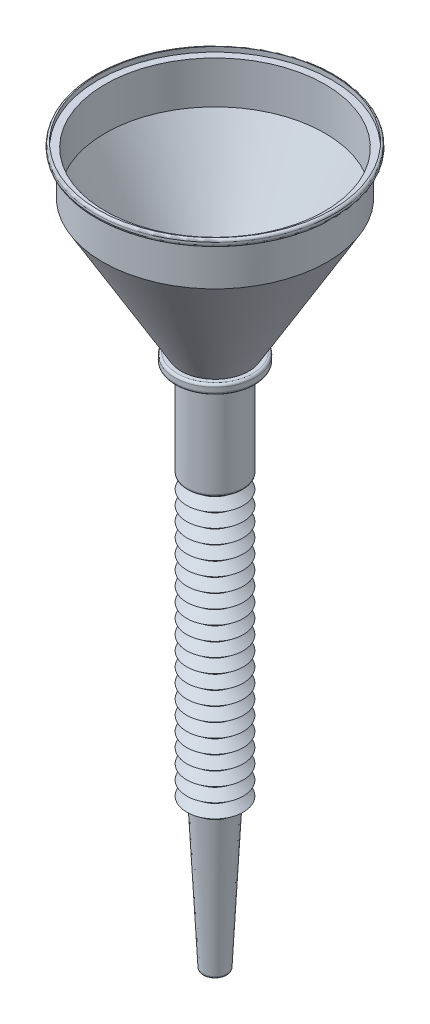
from build123d import *

# Parameters (mm, degrees)
FILLET1_R = 1.27


# Read off the part's stored shape, not the designer's step: Shell1
with BuildPart() as part:
    # Sketch1 → Revolve1 (revolve)
    with BuildSketch(Plane.XY, mode=Mode.PRIVATE) as revolve1_sk:
        Polygon((0, 0), (63.5, 0), (63.5, -3.81), (59.69, -3.81), (59.69, -25.4), (17.979333333, -96.52), (21.35, -96.52), (21.35, -101.6), (15, -101.6), (15, -152.4), (10.16, -152.4), (10.16, -304.8), (6.35, -381), (0, -381), align=None)
    revolve(revolve1_sk.sketch.rotate(Axis((0, 0, 0), (0, 1, 0)), 90), axis=Axis((0, 0, 0), (0, 1, 0)))

    # Sketch3 → Revolve2 (revolve)
    with BuildSketch(Plane.XY, mode=Mode.PRIVATE) as revolve2_sk:
        Polygon((15, -152.4), (10.16, -156.117073171), (15, -159.834146341), (10.16, -163.551219512), (15, -167.268292683), (10.16, -170.985365854), (15, -174.702439024), (10.16, -178.419512195), (15, -182.136585366), (10.16, -185.853658537), (15, -189.570731707), (10.16, -193.287804878), (15, -197.004878049), (10.16, -200.72195122), (15, -204.43902439), (10.16, -208.156097561), (15, -211.873170732), (10.16, -215.590243902), (15, -219.307317073), (10.16, -223.024390244), (15, -226.741463415), (10.16, -230.458536585), (15, -234.175609756), (10.16, -237.892682927), (15, -241.609756098), (10.16, -245.326829268), (15, -249.043902439), (10.16, -252.76097561), (15, -256.47804878), (10.16, -260.195121951), (15, -263.912195122), (10.16, -267.629268293), (15, -271.346341463), (10.16, -275.063414634), (15, -278.780487805), (10.16, -282.497560976), (15, -286.214634146), (10.16, -289.931707317), (15, -293.648780488), (10.16, -297.365853659), (15, -301.082926829), (10.16, -304.8), (0, -304.8), (0, -152.4), align=None)
    revolve(revolve2_sk.sketch.rotate(Axis((0, -152.4, 0), (0, -1, 0)), 90), axis=Axis((0, -152.4, 0), (0, -1, 0)))

    # Shell1 outline → Shell1 (revolve, cut)
    with BuildSketch(Plane.XY):
        Polygon((5.078413491, -381), (8.92089823, -304.150305222), (12.91493083, -301.082926829), (8.07493083, -297.365853659), (12.91493083, -293.648780488), (8.07493083, -289.931707317), (12.91493083, -286.214634146), (8.07493083, -282.497560976), (12.91493083, -278.780487805), (8.07493083, -275.063414634), (12.91493083, -271.346341463), (8.07493083, -267.629268293), (12.91493083, -263.912195122), (8.07493083, -260.195121951), (12.91493083, -256.47804878), (8.07493083, -252.76097561), (12.91493083, -249.043902439), (8.07493083, -245.326829268), (12.91493083, -241.609756098), (8.07493083, -237.892682927), (12.91493083, -234.175609756), (8.07493083, -230.458536585), (12.91493083, -226.741463415), (8.07493083, -223.024390244), (12.91493083, -219.307317073), (8.07493083, -215.590243902), (12.91493083, -211.873170732), (8.07493083, -208.156097561), (12.91493083, -204.43902439), (8.07493083, -200.72195122), (12.91493083, -197.004878049), (8.07493083, -193.287804878), (12.91493083, -189.570731707), (8.07493083, -185.853658537), (12.91493083, -182.136585366), (8.07493083, -178.419512195), (12.91493083, -174.702439024), (8.07493083, -170.985365854), (12.91493083, -167.268292683), (8.07493083, -163.551219512), (12.91493083, -159.834146341), (8.07493083, -156.117073171), (13.73, -151.774034763), (13.73, -100.33), (20.08, -100.33), (20.08, -97.79), (15.762196806, -97.79), (58.42, -25.055056984), (58.42, -2.54), (62.23, -2.54), (62.23, 0), (0, 0), (0, -381), align=None)
    revolve(axis=Axis((0, 0, 0), (0, 1, 0)), mode=Mode.SUBTRACT)

    # Fillet1
    fillet1_edges = [part.edges().sort_by_distance(p)[0] for p in [
        (0, 0, 63.5),
        (0, -3.81, 63.5),
        (0, -96.52, 21.35),
        (0, -101.6, 21.35),
        (0, -101.6, 15),
        (-15, -152.4, 0),
        (0, -381, 6.35),
    ]]
    fillet(fillet1_edges, radius=FILLET1_R - 0.0001)  # a hair under: the kernel refuses the full size


solid = part.part
